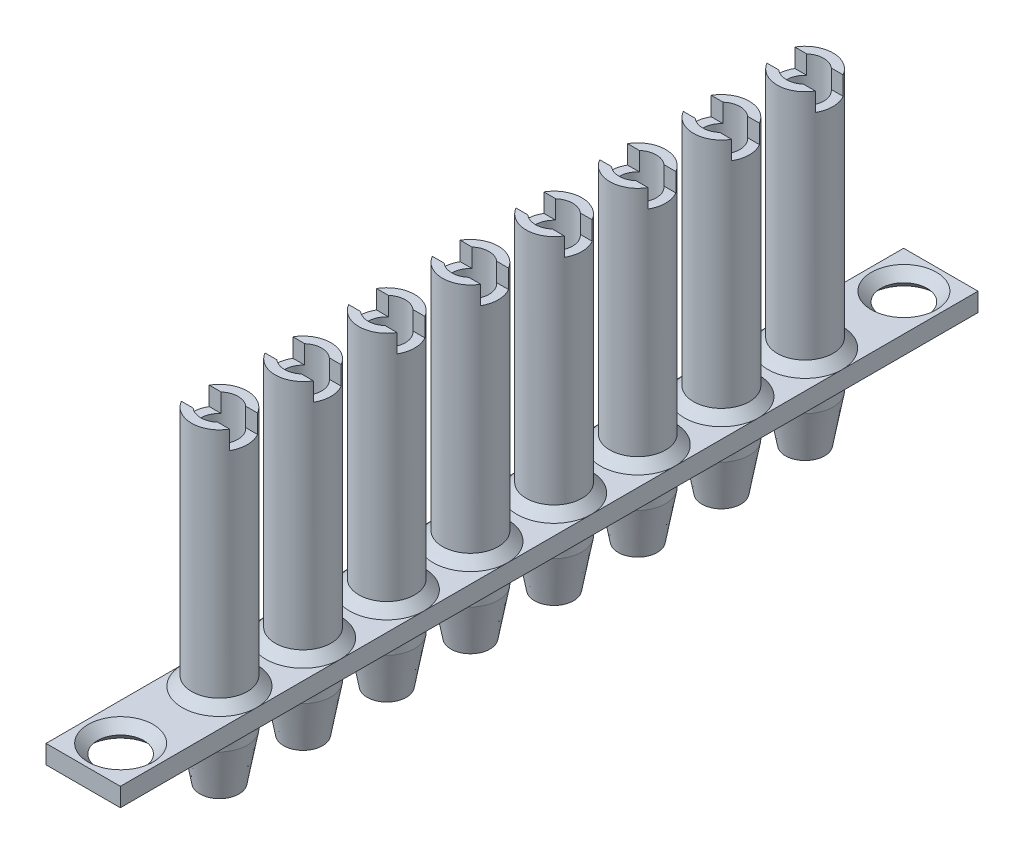
from build123d import *

# Parameters (mm, degrees)
SHELL1_T            = -1
LPATTERN1_COUNT     = 8
LPATTERN1_PITCH     = 9
SKETCH3_W           = 8
SKETCH3_H           = 92.26
BOSS_EXTRUDE1_DEPTH = 1
CHAMFER1_SIZE       = 1
SKETCH4_R           = 2.5
CUT_EXTRUDE1_DEPTH  = 82.991962069
CHAMFER2_SIZE       = 1
SKETCH5_W           = 3
SKETCH5_H           = 2
CUT_EXTRUDE2_DEPTH  = 84.346756649
LPATTERN2_COUNT     = 8
LPATTERN2_PITCH     = 9


with BuildPart() as part:
    # Sketch1 → Revolve1 (revolve)
    with BuildSketch(Plane.XY, mode=Mode.PRIVATE) as revolve1_sk:
        Polygon((0, 30), (3, 30), (3, 0), (2.1, -5), (0, -5), align=None)
    revolve(revolve1_sk.sketch.rotate(Axis((0, 30, 0), (0, -1, 0)), 180), axis=Axis((0, 30, 0), (0, -1, 0)))

    # Shell1
    shell1_openings = [part.faces().sort_by_distance(p)[0] for p in [
        (0, -5, 0),
        (0, 30, 0),
    ]]
    offset(amount=SHELL1_T, openings=shell1_openings, kind=Kind.INTERSECTION)


with BuildPart() as lpattern1_1:
    # LPattern1: pattern copy
    add(part.part.moved(Location(Vector(0, 0, 1) * (1 * LPATTERN1_PITCH))))


with BuildPart() as lpattern1_2:
    # LPattern1: pattern copy
    add(part.part.moved(Location(Vector(0, 0, 1) * (2 * LPATTERN1_PITCH))))


with BuildPart() as lpattern1_3:
    # LPattern1: pattern copy
    add(part.part.moved(Location(Vector(0, 0, 1) * (3 * LPATTERN1_PITCH))))


with BuildPart() as lpattern1_4:
    # LPattern1: pattern copy
    add(part.part.moved(Location(Vector(0, 0, 1) * (4 * LPATTERN1_PITCH))))


with BuildPart() as lpattern1_5:
    # LPattern1: pattern copy
    add(part.part.moved(Location(Vector(0, 0, 1) * (5 * LPATTERN1_PITCH))))


with BuildPart() as lpattern1_6:
    # LPattern1: pattern copy
    add(part.part.moved(Location(Vector(0, 0, 1) * (6 * LPATTERN1_PITCH))))


with BuildPart() as lpattern1_7:
    # LPattern1: pattern copy
    add(part.part.moved(Location(Vector(0, 0, 1) * (7 * LPATTERN1_PITCH))))


with BuildPart() as part_1:
    add(part.part)

    add(lpattern1_1.part)  # Boss-Extrude1 merges LPattern1_1

    add(lpattern1_2.part)  # Boss-Extrude1 merges LPattern1_2

    add(lpattern1_3.part)  # Boss-Extrude1 merges LPattern1_3

    add(lpattern1_4.part)  # Boss-Extrude1 merges LPattern1_4

    add(lpattern1_5.part)  # Boss-Extrude1 merges LPattern1_5

    add(lpattern1_6.part)  # Boss-Extrude1 merges LPattern1_6

    add(lpattern1_7.part)  # Boss-Extrude1 merges LPattern1_7
    # Sketch3 → Boss-Extrude1 (add, symmetric)
    with BuildSketch(Plane(origin=(0, 3, 0), x_dir=(-1, 0, 0), z_dir=(0, -1, 0))):
        with Locations((0, -31.527464831)):
            Rectangle(SKETCH3_W, SKETCH3_H)
    extrude(amount=BOSS_EXTRUDE1_DEPTH, both=True)

    # Chamfer1
    chamfer1_edges = [part_1.edges().sort_by_distance(p)[0] for p in [
        (3, 4, 0),
        (3, 2, 0),
        (3, 4, 9),
        (3, 2, 9),
        (3, 4, 18),
        (3, 2, 18),
        (3, 4, 27),
        (3, 2, 27),
        (3, 4, 36),
        (3, 2, 36),
        (3, 4, 45),
        (3, 2, 45),
        (3, 4, 54),
        (3, 2, 54),
        (3, 4, 63),
        (3, 2, 63),
    ]]
    chamfer(chamfer1_edges, length=CHAMFER1_SIZE - 0.0001)  # a hair under: the kernel refuses the full size

    # Sketch4 → Cut-Extrude1 (cut, through all)
    with BuildSketch(Plane(origin=(0, 4, 0), x_dir=(1, 0, 0), z_dir=(0, 1, 0))):
        with Locations(Location((0, -73.63, 0), (0, 0, 270))):
            Circle(SKETCH4_R)
        with Locations(Location((0, 10.63, 0), (0, 0, 270))):
            Circle(SKETCH4_R)
    extrude(amount=-CUT_EXTRUDE1_DEPTH, mode=Mode.SUBTRACT)

    # Chamfer2
    chamfer2_edges = [part_1.edges().sort_by_distance(p)[0] for p in [
        (0, 2, 71.13),
        (0, 4, 71.13),
        (0, 2, -13.13),
        (0, 4, -13.13),
    ]]
    chamfer(chamfer2_edges, length=CHAMFER2_SIZE - 0.0001)  # a hair under: the kernel refuses the full size

    # Sketch5 → Cut-Extrude2 (cut, symmetric)
    with BuildSketch(Plane(origin=(0, 0, 0), x_dir=(0, 0, -1), z_dir=(1, 0, 0))):
        with Locations((0, 29)):
            Rectangle(SKETCH5_W, SKETCH5_H)
    cut_extrude2 = extrude(amount=CUT_EXTRUDE2_DEPTH, both=True, mode=Mode.SUBTRACT)

    # LPattern2: Cut-Extrude2 ×8
    with Locations(*[(0, 0, i * LPATTERN2_PITCH) for i in range(1, LPATTERN2_COUNT)]):
        add(cut_extrude2, mode=Mode.SUBTRACT)


solid = part_1.part
